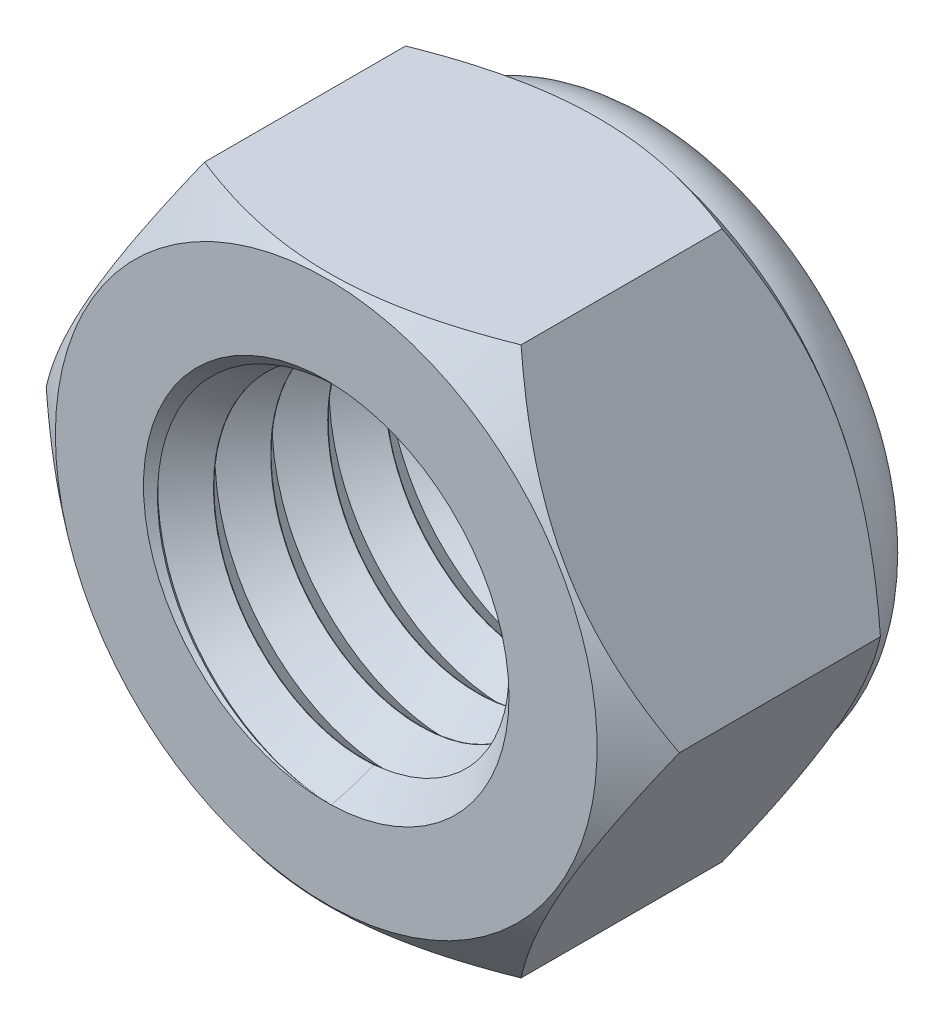
from build123d import *

# Parameters (mm, degrees)
ESBO_O1_R                 = 3.4
RESSALTO_EXTRUS_O1_DEPTH  = 6
CHANFRO1_SIZE             = 0.6
VARREDURA_DE_CORTE1_PITCH = 1.25


with BuildPart() as part:
    # Esboço1 → Ressalto-extrusão1 (new body)
    with BuildSketch(Plane.XY):
        Polygon((6.92820323, 0), (3.464101615, 6), (-3.464101615, 6), (-6.92820323, 0), (-3.464101615, -6), (3.464101615, -6), align=None)
        Circle(ESBO_O1_R, mode=Mode.SUBTRACT)
    extrude(amount=RESSALTO_EXTRUS_O1_DEPTH)

    # Esboço2 → Corte-Revolução1 (revolve, cut)
    with BuildSketch(Plane(origin=(0, 0, 0), x_dir=(1, 0, 0), z_dir=(0, 1, 0)), mode=Mode.PRIVATE) as corte_revolu_o1_sk:
        Polygon((6.92820323, -6), (6.92820323, -5.2), (5.92820323, -6), align=None)
        Polygon((6.92820323, 0), (6.92820323, -0.8), (5.92820323, 0), align=None)
    revolve(corte_revolu_o1_sk.sketch.rotate(Axis((0, 0, 0), (0, 0, 1)), 180), axis=Axis((0, 0, 0), (0, 0, 1)), mode=Mode.SUBTRACT)

    # Chanfro1
    chanfro1_edges = [part.edges().sort_by_distance(p)[0] for p in [
        (-3.4, 0, 6),
    ]]
    chamfer(chanfro1_edges, length=CHANFRO1_SIZE)

    # Esboço3 → Revolução1 (revolve)
    with BuildSketch(Plane(origin=(0, 0, 0), x_dir=(0, 0, -1), z_dir=(1, 0, 0)), mode=Mode.PRIVATE) as revolu_o1_sk:
        with BuildLine():
            Line((1.4, 4.52820323), (1.4, 4.12820323))
            Line((1.4, 4.12820323), (1.17, 4.12820323))
            Line((1.17, 4.12820323), (1.17, 4.52820323))
            ThreePointArc((1.17, 4.52820323), (0.827314934, 5.355518164), (0, 5.69820323))
            Line((0, 5.69820323), (0, 5.92820323))
            ThreePointArc((0, 5.92820323), (0.989949494, 5.518152724), (1.4, 4.52820323))
        make_face()
    revolve(revolu_o1_sk.sketch.rotate(Axis((0, 0, 8.585027381), (0, 0, -1)), 90), axis=Axis((0, 0, 8.585027381), (0, 0, -1)))

    # Varredura de corte1: the profile of Esboço6 profile screwed along a right-hand helix of 7 turns, 8 arcs to a turn; built about Z, then put on its axis
    varredura_de_corte1_z = Axis((0, 0, 0), (0, 0, 1))
    varredura_de_corte1_corners = [(3.3997, 0, 0.00031), (4, 0, -0.62), (3.3997, 0, -1.24031)]
    with BuildLine(mode=Mode.PRIVATE) as varredura_de_corte1_profile:
        Line(varredura_de_corte1_corners[0], varredura_de_corte1_corners[1])
        Line(varredura_de_corte1_corners[1], varredura_de_corte1_corners[2])
        Line(varredura_de_corte1_corners[2], varredura_de_corte1_corners[0])
    varredura_de_corte1_cap = Face(varredura_de_corte1_profile.wire())
    varredura_de_corte1_turn_angles = [0, 22.5, 45, 67.5, 90, 112.5, 135, 157.5, 180, 202.5, 225, 247.5, 270, 292.5, 315, 337.5, 360]
    varredura_de_corte1_turn_weights = [1, 0.9238795325112867, 1, 0.9238795325112867, 1, 0.9238795325112867, 1, 0.9238795325112867, 1, 0.9238795325112867, 1, 0.9238795325112867, 1, 0.9238795325112867, 1, 0.9238795325112867, 1]
    varredura_de_corte1_turn_rails = [Edge.make_bspline([Vector(p[0], p[1], 0).rotate(varredura_de_corte1_z, varredura_de_corte1_turn_angles[k]) / varredura_de_corte1_turn_weights[k] + Vector(0, 0, p[2] + VARREDURA_DE_CORTE1_PITCH * varredura_de_corte1_turn_angles[k] / 360) for k in range(17)], [0, 0, 0, 1, 1, 2, 2, 3, 3, 4, 4, 5, 5, 6, 6, 7, 7, 8, 8, 8], 2, varredura_de_corte1_turn_weights) for p in varredura_de_corte1_corners]
    varredura_de_corte1_turn_sides = [Face.make_surface_from_curves(varredura_de_corte1_turn_rails[p[0]], varredura_de_corte1_turn_rails[p[1]]) for p in [(0, 1), (1, 2), (2, 0)]]
    varredura_de_corte1 = Plane(origin=(0, 0, 6), x_dir=(0, 1, 0), z_dir=(0, 0, -1)) * Solid(Shell([*[p.moved(Location((0, 0, VARREDURA_DE_CORTE1_PITCH * i))) for i in range(7) for p in varredura_de_corte1_turn_sides], varredura_de_corte1_cap, varredura_de_corte1_cap.rotate(varredura_de_corte1_z, 2520).moved(Location((0, 0, VARREDURA_DE_CORTE1_PITCH * 2520 / 360)))]))
    add(varredura_de_corte1, mode=Mode.SUBTRACT)


with BuildPart() as body_2:
    # Esboço4 → Revolução2 (revolve)
    with BuildSketch(Plane(origin=(0, 0, 0), x_dir=(0, 0, -1), z_dir=(1, 0, 0)), mode=Mode.PRIVATE) as revolu_o2_sk:
        with BuildLine():
            Line((1.13, 4.53), (1.13, 3.4))
            Line((1.13, 3.4), (0.033444017, 3.4))
            Line((0.033444017, 3.4), (0.033444017, 5.659504979))
            ThreePointArc((0.033444017, 5.659504979), (0.810768691, 5.317117609), (1.13, 4.53))
        make_face()
    revolve(revolu_o2_sk.sketch.rotate(Axis((0, 0, 10.977563204), (0, 0, -1)), 90), axis=Axis((0, 0, 10.977563204), (0, 0, -1)))


solid = Compound([part.part, body_2.part])
